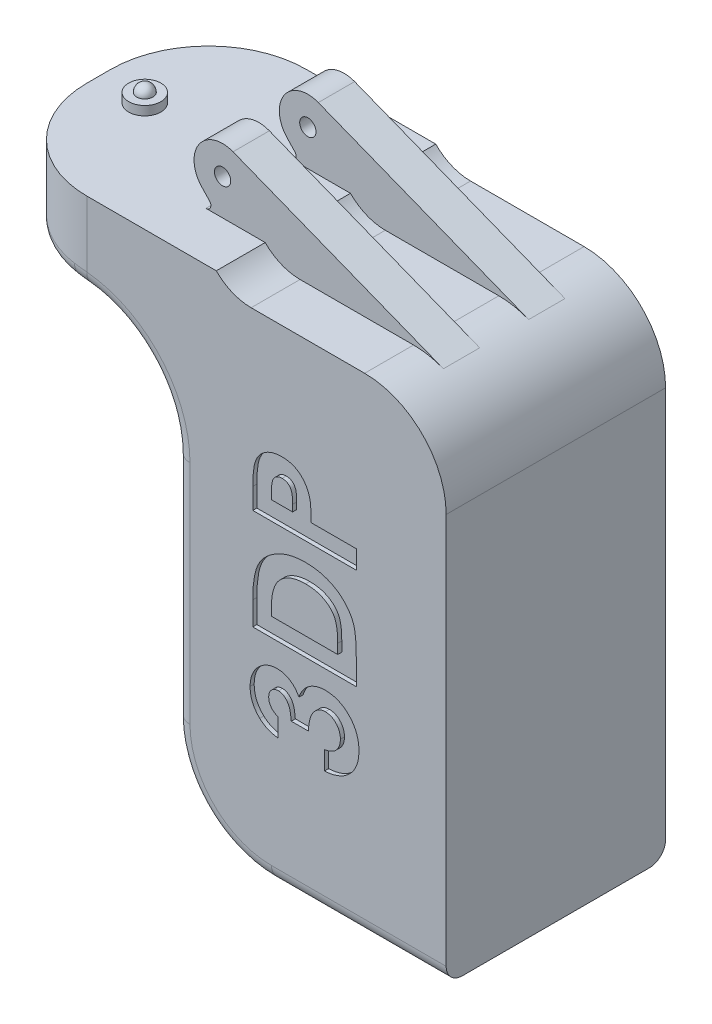
from build123d import *

# Parameters (mm, degrees)
BOSS_EXTRUDE1_DEPTH = 26.91519165
BOSS_EXTRUDE2_DEPTH = 26.91519165
FILLET1_R           = 12
FILLET2_R           = 12
SKETCH4_R           = 1.975
CUT_EXTRUDE1_DEPTH  = 5
FILLET3_R           = 2
FILLET4_R           = 0.6
SKETCH5_R           = 1
CUT_EXTRUDE2_DEPTH  = 33
SKETCH6_W           = 18.03011809
SKETCH6_H           = 6
CUT_EXTRUDE3_DEPTH  = 33
SKETCH7_W           = 12.282064414
SKETCH7_H           = 6
CUT_EXTRUDE4_DEPTH  = 33
FILLET5_R           = 10
BOSS_EXTRUDE3_DEPTH = 4.457595825
BOSS_EXTRUDE4_START = -4.457595825
BOSS_EXTRUDE4_DEPTH = 4.457595825
WRAP1_START         = -0.5
WRAP1_DEPTH         = 0.5
WRAP2_START         = -0.5
WRAP2_DEPTH         = 0.5
BOSS_EXTRUDE5_START = 6.11
SKETCH13_R          = 1.975
BOSS_EXTRUDE5_DEPTH = 6.11
SKETCH14_R          = 1
BOSS_EXTRUDE6_DEPTH = 1
FILLET6_R           = 1


# Read off the part's stored shape, not the designer's step: Wrap1, Wrap2
with BuildPart() as part:
    # Sketch1 → Boss-Extrude1 (new body)
    with BuildSketch(Plane.XY):
        with BuildLine():
            Line((20.5, -63.197553089), (50.42158649, -63.197553089))
            Line((50.42158649, -63.197553089), (50.42158649, -3.197553089))
            Line((50.42158649, -3.197553089), (26.5, -3.197553089))
            ThreePointArc((26.5, -3.197553089), (22.257359313, -1.440193776), (20.5, 2.802446911))
            Line((20.5, 2.802446911), (20.5, 3))
            ThreePointArc((20.5, 3), (15.70294041, 6.250790123), (14.461350617, 0.590589427))
            Line((14.461350617, 0.590589427), (17, -2.08423103))
            Line((17, -2.08423103), (17, -63.197553089))
            Line((17, -63.197553089), (20.5, -63.197553089))
        make_face()
    extrude(amount=-BOSS_EXTRUDE1_DEPTH)

    # Sketch3 → Boss-Extrude2 (add)
    with BuildSketch(Plane.XY):
        Polygon((16.359537753, -1.409414913), (-5.640462247, -1.409414913), (-5.640462247, -11.409414913), (17, -11.409414913), (17, -2.08423103), align=None)
    extrude(amount=-BOSS_EXTRUDE2_DEPTH)

    # Fillet1
    fillet1_edges = [part.edges().sort_by_distance(p)[0] for p in [
        (-5.640462247, -6.409414913, 0),
        (-5.640462247, -6.409414913, -26.91519165),
    ]]
    fillet(fillet1_edges, radius=FILLET1_R)

    # Fillet2
    fillet2_edges = [part.edges().sort_by_distance(p)[0] for p in [
        (17, -63.197553089, -13.457595825),
        (17, -11.409414913, -13.457595825),
    ]]
    fillet(fillet2_edges, radius=FILLET2_R)

    # Sketch4 → Cut-Extrude1 (cut)
    with BuildSketch(Plane(origin=(0, -1.409414913, 0), x_dir=(1, 0, 0), z_dir=(0, 1, 0))):
        with Locations(Location((0, 13.457595825, 0), (0, 0, 180))):
            Circle(SKETCH4_R)
    extrude(amount=-CUT_EXTRUDE1_DEPTH, mode=Mode.SUBTRACT)

    # Fillet3
    fillet3_edges = [part.edges().sort_by_distance(p)[0] for p in [
        (-5.640462247, -11.409414913, -13.457595825),
        (-2.593519072, -11.409414913, -22.90535895),
        (17, -37.303484001, -26.91519165),
        (17, -37.303484001, 0),
        (39.710793245, -63.197553089, 0),
        (20.514718626, -59.682834464, 0),
        (39.710793245, -63.197553089, -26.91519165),
        (20.514718626, -59.682834464, -26.91519165),
        (-2.593519072, -11.409414913, -4.0098327),
        (5.679768877, -11.428683956, -0.019269043),
        (13.953056825, -15.419247614, 0),
        (13.953056825, -15.419247614, -26.91519165),
        (5.679768877, -11.428683956, -26.895922607),
    ]]
    fillet(fillet3_edges, radius=FILLET3_R)

    # Fillet4
    fillet4_edges = [part.edges().sort_by_distance(p)[0] for p in [
        (16.359537753, -1.409414913, -13.457595825),
    ]]
    fillet(fillet4_edges, radius=FILLET4_R)

    # Sketch5 → Cut-Extrude2 (cut)
    with BuildSketch(Plane.XY):
        with Locations((17, 3)):
            Circle(SKETCH5_R)
    extrude(amount=-CUT_EXTRUDE2_DEPTH, mode=Mode.SUBTRACT)

    # Sketch6 → Cut-Extrude3 (cut)
    with BuildSketch(Plane(origin=(0, -1.409414913, 0), x_dir=(1, 0, 0), z_dir=(0, 1, 0))):
        with Locations((18.559970367, 3)):
            Rectangle(SKETCH6_W, SKETCH6_H)
    extrude(amount=CUT_EXTRUDE3_DEPTH, mode=Mode.SUBTRACT)

    # Sketch7 → Cut-Extrude4 (cut)
    with BuildSketch(Plane(origin=(0, -1.409414913, 0), x_dir=(1, 0, 0), z_dir=(0, 1, 0))):
        with Locations((16.08576993, 23.91519165)):
            Rectangle(SKETCH7_W, SKETCH7_H)
        with Locations((16.08576993, 13.457595825)):
            Rectangle(SKETCH7_W, SKETCH7_H)
    extrude(amount=CUT_EXTRUDE4_DEPTH, mode=Mode.SUBTRACT)

    # Fillet5
    fillet5_edges = [part.edges().sort_by_distance(p)[0] for p in [
        (50.42158649, -3.197553089, -13.457595825),
    ]]
    fillet(fillet5_edges, radius=FILLET5_R)

    # Sketch8 → Boss-Extrude3 (add)
    with BuildSketch(Plane.XY.offset(-6)):
        with BuildLine():
            Line((18.28116245, 6.257088082), (44.082050633, -3.89158714))
            ThreePointArc((44.082050633, -3.89158714), (42.284425788, -3.37259356), (40.42158649, -3.197553089))
            Line((40.42158649, -3.197553089), (26.5, -3.197553089))
            ThreePointArc((26.5, -3.197553089), (24.183879423, -2.732495318), (22.226802137, -1.409414913))
            ThreePointArc((22.226802137, -1.409414913), (20.948460251, 0.526396294), (20.5, 2.802446911))
            Line((20.5, 2.802446911), (20.5, 3))
            ThreePointArc((20.5, 3), (19.892582633, 4.970524223), (18.28116245, 6.257088082))
        make_face()
    extrude(amount=-BOSS_EXTRUDE3_DEPTH)

    # Sketch10 → Boss-Extrude4 (add)
    with BuildSketch(Plane(origin=(0, 0, -20.91519165), x_dir=(-1, 0, 0), z_dir=(0, 0, -1)).offset(BOSS_EXTRUDE4_START)):
        with BuildLine():
            Line((-44.082050633, -3.89158714), (-18.28116245, 6.257088082))
            ThreePointArc((-18.28116245, 6.257088082), (-19.892582633, 4.970524223), (-20.5, 3))
            Line((-20.5, 3), (-20.5, 2.802446911))
            ThreePointArc((-20.5, 2.802446911), (-20.948460251, 0.526396294), (-22.226802137, -1.409414913))
            ThreePointArc((-22.226802137, -1.409414913), (-24.183879423, -2.732495318), (-26.5, -3.197553089))
            Line((-26.5, -3.197553089), (-40.42158649, -3.197553089))
            ThreePointArc((-40.42158649, -3.197553089), (-42.284425788, -3.37259356), (-44.082050633, -3.89158714))
        make_face()
    extrude(amount=BOSS_EXTRUDE4_DEPTH)

    # Wrap1 outline → Wrap1 (cut)
    # profile 1 of 3: a face of its own
    with BuildSketch(Plane.XY.offset(WRAP1_START)):
        with BuildLine():
            add(Edge.make_bspline(
                [(29.793662682, -47.259674624), (29.679694315, -47.243680976), (29.457085889, -47.212441424), (29.134033392, -47.135646016), (28.826834298, -47.046836784), (28.53713725, -46.933262335), (28.265254543, -46.802161124), (28.010942879, -46.649279319), (27.770552672, -46.481710734), (27.626494259, -46.350515009), (27.554880631, -46.285295618)],
                knots=[0, 0, 0, 0, 0.138943325, 0.2713907, 0.400711228, 0.524932707, 0.646800357, 0.764858493, 0.883107579, 1, 1, 1, 1], degree=3))
            Line((29.793662682, -47.259674624), (29.793662682, -44.980187445))
            add(Edge.make_bspline(
                [(28.653919092, -43.494450265), (28.657984461, -43.577042735), (28.666051398, -43.740931491), (28.726260879, -43.980585907), (28.827616047, -44.208177758), (28.96737885, -44.418994259), (29.135228052, -44.60999223), (29.334010592, -44.766746459), (29.551817063, -44.897127195), (29.712731442, -44.952392155), (29.793662682, -44.980187445)],
                knots=[0, 0, 0, 0, 0.123522589, 0.245106649, 0.36726561, 0.494690546, 0.622323873, 0.746002836, 0.872253148, 1, 1, 1, 1], degree=3))
            add(Edge.make_bspline(
                [(29.849632233, -42.212238727), (29.766930947, -42.21661778), (29.605515545, -42.225164764), (29.374084101, -42.29284717), (29.166688952, -42.407707014), (28.985649891, -42.563553512), (28.837973958, -42.755012631), (28.728141079, -42.976591692), (28.664068623, -43.227167915), (28.657378891, -43.40333836), (28.653919092, -43.494450265)],
                knots=[0, 0, 0, 0, 0.126165598, 0.246248538, 0.364494603, 0.485724426, 0.608514578, 0.73130473, 0.861036067, 1, 1, 1, 1], degree=3))
            add(Edge.make_bspline(
                [(31.42186781, -44.654546419), (31.40904774, -44.503428084), (31.385063928, -44.220715606), (31.328187448, -43.828565407), (31.254610772, -43.497301408), (31.158720422, -43.223137182), (31.046713588, -42.99171911), (30.916934876, -42.792391977), (30.767908317, -42.618485027), (30.599851049, -42.475439303), (30.423692764, -42.356231745), (30.236339235, -42.27462788), (30.045244717, -42.21993119), (29.914444082, -42.214787453), (29.849632233, -42.212238727)],
                knots=[0, 0, 0, 0, 0.141725991, 0.265141262, 0.370116044, 0.458355648, 0.535986621, 0.609852304, 0.680090865, 0.749211452, 0.815601441, 0.878051616, 0.93957445, 1, 1, 1, 1], degree=3))
            Line((31.42186781, -44.654546419), (33.538534477, -44.654546419))
            add(Edge.make_bspline(
                [(35.591599381, -41.560956675), (35.521865865, -41.563278441), (35.383876528, -41.567872773), (35.181659761, -41.608302676), (34.986390275, -41.668820275), (34.799679191, -41.755855816), (34.622624577, -41.869745696), (34.45376006, -42.00822411), (34.294430079, -42.17254377), (34.139994301, -42.35720205), (34.004801952, -42.569649592), (33.880310015, -42.801307426), (33.78118375, -43.057882639), (33.692667259, -43.333219952), (33.628010792, -43.632496359), (33.581065463, -43.953862488), (33.546121475, -44.296797294), (33.541108222, -44.533186823), (33.538534477, -44.654546419)],
                knots=[0, 0, 0, 0, 0.050616766, 0.100160932, 0.149266408, 0.198883313, 0.249304704, 0.301846101, 0.357178164, 0.415398685, 0.476408327, 0.539798233, 0.60615782, 0.675919782, 0.74976587, 0.828276339, 0.911839098, 1, 1, 1, 1], degree=3))
            add(Edge.make_bspline(
                [(37.446226785, -43.560596098), (37.445011729, -43.490133273), (37.442631707, -43.352112362), (37.416491829, -43.149328443), (37.372939422, -42.956346104), (37.31535741, -42.771562698), (37.237218938, -42.597882151), (37.146539501, -42.431372035), (37.03553414, -42.27507746), (36.909054065, -42.129908906), (36.773996634, -41.994805434), (36.626208402, -41.879442714), (36.472785654, -41.779844315), (36.30967031, -41.701254478), (36.142011638, -41.635479646), (35.964480714, -41.594456903), (35.780931109, -41.563668655), (35.655339645, -41.561869688), (35.591599381, -41.560956675)],
                knots=[0, 0, 0, 0, 0.069418935, 0.135976164, 0.201068785, 0.264244252, 0.326365932, 0.38847074, 0.450850536, 0.514855453, 0.578097235, 0.638796917, 0.699312171, 0.757998888, 0.816988375, 0.876385038, 0.937262852, 1, 1, 1, 1], degree=3))
            add(Edge.make_bspline(
                [(35.492380631, -45.631469496), (35.572252479, -45.617021806), (35.727823851, -45.588881142), (35.953078761, -45.53404413), (36.160921135, -45.462395911), (36.35287794, -45.380480737), (36.530919166, -45.289913895), (36.690283678, -45.181702221), (36.837234507, -45.065675298), (37.006144585, -44.891260395), (37.183282522, -44.647911648), (37.340163988, -44.318431755), (37.429388386, -43.950244583), (37.440489168, -43.693367265), (37.446226785, -43.560596098)],
                knots=[0, 0, 0, 0, 0.077370852, 0.150700025, 0.220747386, 0.286665961, 0.349581574, 0.410791325, 0.470003976, 0.527741387, 0.64173813, 0.755286834, 0.87351607, 1, 1, 1, 1], degree=3))
            Line((35.492380631, -45.631469496), (35.492380631, -47.910956675))
            add(Edge.make_bspline(
                [(39.725713964, -43.685255553), (39.72247289, -43.833828888), (39.716135397, -44.124344383), (39.66128119, -44.549284097), (39.572796902, -44.953149071), (39.448070962, -45.336969976), (39.286322731, -45.69926184), (39.093716882, -46.043310066), (38.859144355, -46.362249248), (38.593194199, -46.659632995), (38.294813224, -46.92886444), (37.970913277, -47.169493949), (37.620262701, -47.3762156), (37.244359619, -47.54987716), (36.842544586, -47.689120989), (36.415634712, -47.798956113), (35.962795948, -47.875677745), (35.651233245, -47.899043478), (35.492380631, -47.910956675)],
                knots=[0, 0, 0, 0, 0.066659045, 0.130342942, 0.191936224, 0.251995802, 0.311121943, 0.3697548, 0.428602208, 0.488435845, 0.548524359, 0.60866107, 0.669235799, 0.730880799, 0.794196272, 0.859830406, 0.928533466, 1, 1, 1, 1], degree=3))
            add(Edge.make_bspline(
                [(35.614496015, -39.281469496), (35.75541144, -39.285828806), (36.03326796, -39.294424477), (36.442521412, -39.349073074), (36.832711166, -39.450814953), (37.208313016, -39.584675133), (37.564529662, -39.76318106), (37.909339638, -39.973432657), (38.231049551, -40.230787146), (38.535833303, -40.519386069), (38.814280771, -40.838218648), (39.060292199, -41.181303188), (39.263089604, -41.549304401), (39.436428178, -41.933325424), (39.565072658, -42.342017422), (39.659280759, -42.770093658), (39.716599833, -43.22068011), (39.722632856, -43.528201954), (39.725713964, -43.685255553)],
                knots=[0, 0, 0, 0, 0.062826775, 0.123881606, 0.183570574, 0.242287944, 0.301291813, 0.360878938, 0.421986412, 0.484557904, 0.547788277, 0.610411137, 0.672354816, 0.73480514, 0.797929196, 0.862961244, 0.93001333, 1, 1, 1, 1], degree=3))
            add(Edge.make_bspline(
                [(32.36571797, -41.63219065), (32.395435252, -41.541662854), (32.453828378, -41.363779795), (32.568904013, -41.110991399), (32.694395385, -40.870420668), (32.840893141, -40.647569372), (32.998243164, -40.436326343), (33.1749057, -40.243375025), (33.366346101, -40.063719006), (33.574600933, -39.901802756), (33.796207672, -39.757042122), (34.027183263, -39.629465989), (34.268371885, -39.522405635), (34.518001132, -39.432550417), (34.778527767, -39.363993374), (35.049068901, -39.315761008), (35.328972672, -39.287872438), (35.518608617, -39.283619798), (35.614496015, -39.281469496)],
                knots=[0, 0, 0, 0, 0.066210963, 0.130101573, 0.192891272, 0.254723742, 0.31534918, 0.375885633, 0.436387606, 0.497731609, 0.559069942, 0.62030329, 0.681020445, 0.742389955, 0.80461491, 0.86812333, 0.933317965, 1, 1, 1, 1], degree=3))
            add(Edge.make_bspline(
                [(29.704620214, -39.932751547), (29.842416769, -39.938147512), (30.114526826, -39.948803049), (30.511996536, -40.033072716), (30.891185338, -40.168541012), (31.247600382, -40.361156854), (31.58087039, -40.603040267), (31.879355738, -40.899664437), (32.147678995, -41.242751757), (32.291877756, -41.500304819), (32.36571797, -41.63219065)],
                knots=[0, 0, 0, 0, 0.124097087, 0.245057399, 0.36448446, 0.485868975, 0.60892619, 0.734308661, 0.863946782, 1, 1, 1, 1], degree=3))
            add(Edge.make_bspline(
                [(26.374431913, -43.479185842), (26.37733782, -43.35609612), (26.383050248, -43.114126531), (26.428906519, -42.758492119), (26.509333311, -42.419424469), (26.614489538, -42.093339536), (26.757572159, -41.785032969), (26.923660628, -41.487700142), (27.127375037, -41.209648544), (27.357551818, -40.950227588), (27.60651054, -40.711899962), (27.872626939, -40.505507193), (28.148792434, -40.328067627), (28.437301437, -40.181880894), (28.73864214, -40.069483162), (29.051073738, -39.991475802), (29.373906829, -39.940418092), (29.593332132, -39.93533141), (29.704620214, -39.932751547)],
                knots=[0, 0, 0, 0, 0.068213911, 0.134094803, 0.198285615, 0.261160186, 0.323634654, 0.38636675, 0.449642386, 0.514244902, 0.578413338, 0.640374686, 0.70061485, 0.760103977, 0.81929898, 0.878465984, 0.938360402, 1, 1, 1, 1], degree=3))
            add(Edge.make_bspline(
                [(27.554880631, -46.285295618), (27.460245557, -46.191457288), (27.273729773, -46.006511803), (27.034823657, -45.697446207), (26.82806666, -45.373488384), (26.664148218, -45.02814122), (26.531475228, -44.666778575), (26.442358481, -44.28652677), (26.383228733, -43.88893965), (26.377404247, -43.617636458), (26.374431913, -43.479185842)],
                knots=[0, 0, 0, 0, 0.127406864, 0.251105539, 0.372907792, 0.494496302, 0.616171436, 0.740562898, 0.867604851, 1, 1, 1, 1], degree=3))
        make_face()
    # profile 2 of 3: a face of its own
    with BuildSketch(Plane.XY.offset(WRAP1_START)):
        with BuildLine():
            add(Edge.make_bspline(
                [(26.700072938, -34.129726707), (26.701602041, -33.905795857), (26.704557813, -33.472934992), (26.73913827, -32.845894461), (26.789912576, -32.262388484), (26.867639291, -31.723746195), (26.957795121, -31.227997365), (27.078733297, -30.778902431), (27.216634224, -30.373204929), (27.379324524, -30.006964684), (27.568904674, -29.672607458), (27.78010635, -29.355128565), (28.020637712, -29.055146138), (28.285866069, -28.768451804), (28.580641597, -28.498745033), (28.900082319, -28.241534344), (29.248820405, -28.003117396), (29.618494261, -27.776287366), (30.010670516, -27.571149788), (30.422011051, -27.392221126), (30.849868736, -27.242331502), (31.294699556, -27.120538419), (31.755026808, -27.023455277), (32.231779389, -26.955528159), (32.724515906, -26.913534938), (33.058467638, -26.909275076), (33.228157874, -26.907110521)],
                knots=[0, 0, 0, 0, 0.060148874, 0.116268453, 0.168655952, 0.21743294, 0.262424792, 0.303924461, 0.342252181, 0.37743397, 0.411399132, 0.445391786, 0.479760229, 0.514578736, 0.550208327, 0.586996019, 0.624658544, 0.663611474, 0.703452918, 0.743447125, 0.784010829, 0.825130466, 0.867263092, 0.910305411, 0.954423665, 1, 1, 1, 1], degree=3))
            Line((26.700072938, -34.129726707), (26.700072938, -37.001982316))
            Line((26.700072938, -37.001982316), (39.400072938, -37.001982316))
            Line((39.400072938, -37.001982316), (39.400072938, -34.086477509))
            add(Edge.make_bspline(
                [(33.228157874, -26.907110521), (33.467601844, -26.912778495), (33.938961313, -26.923936232), (34.630675905, -27.017922776), (35.293753331, -27.169930842), (35.923006744, -27.383667989), (36.512832544, -27.648644836), (37.052829427, -27.965189349), (37.540098861, -28.328660259), (37.972215016, -28.73482307), (38.343623694, -29.174598582), (38.661711623, -29.63161364), (38.912537941, -30.110322131), (39.071637644, -30.532127029), (39.17049322, -30.897894585), (39.229227491, -31.219000738), (39.281638665, -31.583991303), (39.328451546, -31.995286488), (39.359650825, -32.452845815), (39.381498194, -32.956746724), (39.397647795, -33.506328066), (39.399243376, -33.888027214), (39.400072938, -34.086477509)],
                knots=[0, 0, 0, 0, 0.065772437, 0.129476892, 0.191428604, 0.252443711, 0.311784541, 0.368814691, 0.42408823, 0.478488396, 0.531389624, 0.581999458, 0.631196377, 0.67949774, 0.705555904, 0.735216023, 0.769126523, 0.806877245, 0.848930943, 0.895117474, 0.945470227, 1, 1, 1, 1], degree=3))
        make_face()
        with BuildLine():
            add(Edge.make_bspline(
                [(37.120585759, -33.531870137), (37.119899873, -33.390228608), (37.118580886, -33.11784605), (37.100458158, -32.72410683), (37.071029, -32.360739082), (37.027498843, -32.027266845), (36.975120922, -31.722923489), (36.910336338, -31.448819175), (36.83155335, -31.20441365), (36.738706801, -30.987691442), (36.632701869, -30.789828851), (36.508920795, -30.606525159), (36.371360763, -30.429614765), (36.216100559, -30.262367314), (36.045162194, -30.104160228), (35.857674297, -29.955926689), (35.654206307, -29.815688968), (35.433683163, -29.687046482), (35.198433435, -29.569492301), (34.950735917, -29.465208567), (34.688527805, -29.378741964), (34.414263688, -29.306876217), (34.125555784, -29.255519992), (33.824542513, -29.213032511), (33.510031286, -29.191128977), (33.296027335, -29.188122853), (33.187452746, -29.186597701)],
                knots=[0, 0, 0, 0, 0.062612326, 0.120406111, 0.174204843, 0.223728185, 0.269030291, 0.310675957, 0.348139427, 0.382401014, 0.41477486, 0.447215928, 0.480063858, 0.51375667, 0.547979264, 0.582933279, 0.619329216, 0.657136258, 0.695697859, 0.735523522, 0.775831512, 0.817659023, 0.860747747, 0.905390435, 0.951999977, 1, 1, 1, 1], degree=3))
            Line((37.120585759, -33.531870137), (37.120585759, -34.722495137))
            Line((37.120585759, -34.722495137), (28.979560118, -34.722495137))
            Line((28.979560118, -34.722495137), (28.979560118, -33.852423021))
            add(Edge.make_bspline(
                [(29.997188323, -30.384854912), (29.914513245, -30.479314588), (29.745658759, -30.672237781), (29.543327904, -31.010947509), (29.365560415, -31.384188086), (29.224610622, -31.80049814), (29.113141516, -32.255854217), (29.036264, -32.752968428), (28.986863323, -33.289178618), (28.982046675, -33.660652544), (28.979560118, -33.852423021)],
                knots=[0, 0, 0, 0, 0.101663476, 0.207636138, 0.318744567, 0.436679942, 0.563506646, 0.698681208, 0.844446556, 1, 1, 1, 1], degree=3))
            add(Edge.make_bspline(
                [(33.187452746, -29.186597701), (33.021068674, -29.189624393), (32.696632625, -29.195526208), (32.224147528, -29.252797822), (31.779788909, -29.345079103), (31.364698281, -29.479507423), (30.976236729, -29.644819104), (30.619410066, -29.855016361), (30.288369519, -30.097329689), (30.094206114, -30.289055244), (29.997188323, -30.384854912)],
                knots=[0, 0, 0, 0, 0.142280365, 0.277435688, 0.406487662, 0.529917848, 0.650133875, 0.766844668, 0.88349908, 1, 1, 1, 1], degree=3))
        make_face(mode=Mode.SUBTRACT)
    # profile 3 of 3: a face of its own
    with BuildSketch(Plane.XY.offset(WRAP1_START)):
        with BuildLine():
            add(Edge.make_bspline(
                [(26.700072938, -22.083552829), (26.700817001, -21.917326561), (26.702252455, -21.596641247), (26.719659281, -21.134186657), (26.750853288, -20.707549596), (26.789404406, -20.31682834), (26.843450697, -19.962182705), (26.905413212, -19.643171282), (26.980892876, -19.359719159), (27.070513958, -19.108657994), (27.17608129, -18.883269215), (27.288838892, -18.670229349), (27.422495572, -18.472744789), (27.567417095, -18.286179159), (27.726618424, -18.111943735), (27.899470362, -17.9487474), (28.08848495, -17.798270622), (28.292360047, -17.661456795), (28.506944899, -17.537277383), (28.732728851, -17.428803993), (28.970040429, -17.340811847), (29.217352269, -17.266998673), (29.474651457, -17.207710866), (29.743520998, -17.168247098), (30.022083378, -17.141441297), (30.211673116, -17.139076057), (30.307564926, -17.137879752)],
                knots=[0, 0, 0, 0, 0.070782813, 0.136554884, 0.197017081, 0.252928598, 0.303693621, 0.349727315, 0.391249604, 0.428488557, 0.463067374, 0.497161963, 0.531014729, 0.564460573, 0.597691279, 0.631412817, 0.665589541, 0.700444444, 0.735874519, 0.771086765, 0.806970339, 0.84353075, 0.880937416, 0.9192925, 0.959179287, 1, 1, 1, 1], degree=3))
            Line((26.700072938, -22.083552829), (26.700072938, -24.627623342))
            Line((26.700072938, -24.627623342), (39.400072938, -24.627623342))
            Line((39.400072938, -24.627623342), (39.400072938, -22.348136162))
            Line((39.400072938, -22.348136162), (33.864175502, -22.348136162))
            add(Edge.make_bspline(
                [(33.670826144, -19.760816451), (33.687024281, -19.825921081), (33.722114662, -19.966958675), (33.757740207, -20.200337155), (33.790495705, -20.469281349), (33.81864509, -20.774660931), (33.837780113, -21.116651958), (33.852723715, -21.494923294), (33.863589256, -21.909646365), (33.863974813, -22.19802839), (33.864175502, -22.348136162)],
                knots=[0, 0, 0, 0, 0.077372749, 0.167614291, 0.272108317, 0.390015992, 0.52136331, 0.667272254, 0.826809521, 1, 1, 1, 1], degree=3))
            add(Edge.make_bspline(
                [(30.307564926, -17.137879752), (30.41364775, -17.139610657), (30.622113537, -17.143012097), (30.927698814, -17.176357162), (31.21904667, -17.233321097), (31.498614271, -17.307769884), (31.761801475, -17.411583781), (32.014890331, -17.530185046), (32.250776514, -17.67610688), (32.472442478, -17.842828857), (32.681571719, -18.024971364), (32.872566669, -18.226564463), (33.045370282, -18.445233691), (33.207455414, -18.674906282), (33.345843948, -18.925046025), (33.474930503, -19.186896398), (33.584309307, -19.467049464), (33.641719441, -19.661984956), (33.670826144, -19.760816451)],
                knots=[0, 0, 0, 0, 0.068872788, 0.135343493, 0.199281685, 0.261540067, 0.322903021, 0.382757342, 0.442826617, 0.502632784, 0.562727297, 0.622715739, 0.682661194, 0.743612561, 0.80501998, 0.868072172, 0.933113132, 1, 1, 1, 1], degree=3))
        make_face()
        with BuildLine():
            add(Edge.make_bspline(
                [(31.584688323, -21.54166581), (31.583757964, -21.394915623), (31.58204609, -21.124893098), (31.557285692, -20.756140104), (31.519478886, -20.459796041), (31.465236039, -20.225697419), (31.382970387, -20.040800969), (31.287637979, -19.881520202), (31.167270123, -19.743766196), (31.027412074, -19.627020793), (30.869864608, -19.532154818), (30.695049852, -19.465470042), (30.505460647, -19.42341865), (30.37309273, -19.419422171), (30.305020855, -19.417366932)],
                knots=[0, 0, 0, 0, 0.155183108, 0.285539224, 0.390561991, 0.471046427, 0.538527135, 0.603746832, 0.666688199, 0.730994992, 0.79575053, 0.860207253, 0.928109812, 1, 1, 1, 1], degree=3))
            Line((31.584688323, -21.54166581), (31.584688323, -22.348136162))
            Line((31.584688323, -22.348136162), (28.979560118, -22.348136162))
            Line((28.979560118, -22.348136162), (28.979560118, -21.630708278))
            add(Edge.make_bspline(
                [(29.231423099, -20.015223502), (29.211033986, -20.05553981), (29.167866055, -20.140897695), (29.11768018, -20.28627045), (29.075342866, -20.454028388), (29.040203304, -20.645304066), (29.012931355, -20.85933443), (28.992075136, -21.096081293), (28.983688038, -21.35589305), (28.980974043, -21.536576582), (28.979560118, -21.630708278)],
                knots=[0, 0, 0, 0, 0.08210116, 0.173824981, 0.278953094, 0.396639095, 0.527315592, 0.671298143, 0.82875438, 1, 1, 1, 1], degree=3))
            add(Edge.make_bspline(
                [(30.305020855, -19.417366932), (30.245531576, -19.419357276), (30.130108071, -19.423219021), (29.96364049, -19.451979434), (29.808762722, -19.496617062), (29.66763372, -19.564837016), (29.536961778, -19.647662256), (29.420814746, -19.752736375), (29.315434874, -19.873908431), (29.259725884, -19.967615769), (29.231423099, -20.015223502)],
                knots=[0, 0, 0, 0, 0.137806221, 0.267377201, 0.390496855, 0.51006691, 0.629459141, 0.747795142, 0.871868075, 1, 1, 1, 1], degree=3))
        make_face(mode=Mode.SUBTRACT)
    extrude(amount=WRAP1_DEPTH, mode=Mode.SUBTRACT)

    # Wrap2 outline → Wrap2 (cut)
    # profile 1 of 3: a face of its own
    with BuildSketch(Plane(origin=(0, 0, -26.91519165), x_dir=(-1, 0, 0), z_dir=(0, 0, -1)).offset(WRAP2_START)):
        with BuildLine():
            add(Edge.make_bspline(
                [(-28.287572938, -42.789742733), (-28.288223995, -42.935190717), (-28.289480018, -43.215790365), (-28.304710977, -43.620438143), (-28.332005783, -43.993745531), (-28.365737846, -44.335626763), (-28.413028886, -44.645941264), (-28.467244362, -44.925077642), (-28.533294589, -45.173093824), (-28.611695294, -45.392786562), (-28.704126662, -45.589953698), (-28.802572667, -45.7765374), (-28.920064501, -45.948320858), (-29.043939394, -46.1139745), (-29.186031068, -46.264027622), (-29.336883113, -46.407841437), (-29.5024782, -46.539325037), (-29.680811844, -46.659087668), (-29.868589201, -46.767730828), (-30.066145962, -46.862648761), (-30.27379474, -46.939640873), (-30.490192284, -47.004227681), (-30.715329161, -47.056104434), (-30.950589985, -47.090635253), (-31.194332074, -47.114090322), (-31.360223094, -47.116159908), (-31.444128427, -47.117206675)],
                knots=[0, 0, 0, 0, 0.070781161, 0.136551696, 0.197012482, 0.252922694, 0.303686532, 0.349719151, 0.391240471, 0.428478555, 0.463056565, 0.497150358, 0.531002334, 0.564226377, 0.59770067, 0.631421421, 0.665597347, 0.700451436, 0.735880684, 0.771092108, 0.806974845, 0.843534403, 0.880940196, 0.919294384, 0.95918024, 1, 1, 1, 1], degree=3))
            Line((-28.287572938, -42.789742733), (-28.287572938, -40.563681034))
            Line((-28.287572938, -40.563681034), (-39.400072938, -40.563681034))
            Line((-39.400072938, -40.563681034), (-39.400072938, -42.558232316))
            Line((-39.400072938, -42.558232316), (-34.556162682, -42.558232316))
            add(Edge.make_bspline(
                [(-34.386981993, -44.822137064), (-34.401155363, -44.765170513), (-34.431859447, -44.641762618), (-34.463031799, -44.437556448), (-34.491692859, -44.202230278), (-34.516323571, -43.935023144), (-34.533066716, -43.635780995), (-34.546142368, -43.304793576), (-34.555649717, -42.941910889), (-34.555987079, -42.689576617), (-34.556162682, -42.558232316)],
                knots=[0, 0, 0, 0, 0.077372749, 0.167614291, 0.272108317, 0.390015992, 0.52136331, 0.667272254, 0.826809521, 1, 1, 1, 1], degree=3))
            add(Edge.make_bspline(
                [(-31.444128427, -47.117206675), (-31.536953589, -47.1156987), (-31.719366438, -47.112735343), (-31.986715453, -47.083465404), (-32.24178206, -47.033956943), (-32.485655749, -46.967678892), (-32.717803555, -46.881228717), (-32.936698432, -46.772876615), (-33.145090744, -46.648940605), (-33.339141372, -46.502614356), (-33.519941978, -46.340978275), (-33.689073682, -46.166730769), (-33.840760074, -45.975922153), (-33.977894661, -45.771211318), (-34.103334712, -45.554292429), (-34.21532969, -45.324170805), (-34.311343496, -45.079221454), (-34.36153507, -44.908627499), (-34.386981993, -44.822137064)],
                knots=[0, 0, 0, 0, 0.068862946, 0.135324151, 0.199253206, 0.26150269, 0.322661372, 0.382747297, 0.442522097, 0.502319717, 0.562770359, 0.622352107, 0.682288995, 0.743375754, 0.805047844, 0.868091026, 0.933122691, 1, 1, 1, 1], degree=3))
        make_face()
        with BuildLine():
            add(Edge.make_bspline(
                [(-32.5616114, -43.263893875), (-32.560800105, -43.392302083), (-32.559307311, -43.628575094), (-32.537610461, -43.95121355), (-32.504616386, -44.210570907), (-32.456925665, -44.415259299), (-32.385866665, -44.57689616), (-32.300307361, -44.714783459), (-32.19733753, -44.836284287), (-32.075941438, -44.939765458), (-31.937796285, -45.02272296), (-31.78375377, -45.08012126), (-31.617315346, -45.117439733), (-31.501474821, -45.120884089), (-31.441902365, -45.122655393)],
                knots=[0, 0, 0, 0, 0.155172457, 0.285519625, 0.390535184, 0.471014095, 0.538490172, 0.60294247, 0.666559525, 0.730176579, 0.794927673, 0.860216848, 0.928114746, 1, 1, 1, 1], degree=3))
            Line((-32.5616114, -43.263893875), (-32.5616114, -42.558232316))
            Line((-32.5616114, -42.558232316), (-30.28212422, -42.558232316))
            Line((-30.28212422, -42.558232316), (-30.28212422, -43.185981715))
            add(Edge.make_bspline(
                [(-30.502504329, -44.599530894), (-30.484663855, -44.564254125), (-30.446891916, -44.489565975), (-30.402979275, -44.362364815), (-30.365934125, -44.215576619), (-30.335187008, -44.048210401), (-30.311324053, -43.860933832), (-30.293074861, -43.653780327), (-30.28573615, -43.42644504), (-30.283361405, -43.26834695), (-30.28212422, -43.185981715)],
                knots=[0, 0, 0, 0, 0.08210116, 0.173824981, 0.278953094, 0.396639095, 0.527315592, 0.671298143, 0.82875438, 1, 1, 1, 1], degree=3))
            add(Edge.make_bspline(
                [(-31.441902365, -45.122655393), (-31.389855475, -45.120901587), (-31.288871992, -45.11749878), (-31.143127779, -45.092500836), (-31.007264107, -45.052661305), (-30.882699892, -44.994935356), (-30.769646789, -44.920309373), (-30.668149332, -44.829325197), (-30.576033869, -44.723150335), (-30.527275747, -44.641177134), (-30.502504329, -44.599530894)],
                knots=[0, 0, 0, 0, 0.137787685, 0.267341238, 0.390444331, 0.511777883, 0.629508981, 0.747829066, 0.87188531, 1, 1, 1, 1], degree=3))
        make_face(mode=Mode.SUBTRACT)
    # profile 2 of 3: a face of its own
    with BuildSketch(Plane(origin=(0, 0, -26.91519165), x_dir=(-1, 0, 0), z_dir=(0, 0, -1)).offset(WRAP2_START)):
        with BuildLine():
            add(Edge.make_bspline(
                [(-28.287572938, -32.24934059), (-28.288942662, -32.44527525), (-28.291590355, -32.824019164), (-28.321420886, -33.372744668), (-28.367303038, -33.882987756), (-28.430406229, -34.355085348), (-28.513961784, -34.788042865), (-28.618593746, -35.181390544), (-28.740150314, -35.536797385), (-28.881413673, -35.858438205), (-29.04717177, -36.151249745), (-29.233372438, -36.427315816), (-29.442834184, -36.689818875), (-29.676037929, -36.940214885), (-29.93143493, -37.179113731), (-30.214167316, -37.400907555), (-30.51691208, -37.612706879), (-30.840719934, -37.81107525), (-31.184951612, -37.987647874), (-31.544189152, -38.144817305), (-31.918666035, -38.275767829), (-32.307865204, -38.382392395), (-32.710659242, -38.467324754), (-33.127815622, -38.526765242), (-33.558960656, -38.563508146), (-33.851168341, -38.567235685), (-33.999647257, -38.569129752)],
                knots=[0, 0, 0, 0, 0.060144747, 0.116260476, 0.168644381, 0.217386628, 0.262418625, 0.303915448, 0.342240538, 0.377628014, 0.411590846, 0.445392104, 0.479758189, 0.514574308, 0.550356234, 0.586999359, 0.624789284, 0.663739542, 0.703473262, 0.743464725, 0.784025647, 0.825142463, 0.867272198, 0.910311565, 0.954426792, 1, 1, 1, 1], degree=3))
            Line((-28.287572938, -32.24934059), (-28.287572938, -29.736116932))
            Line((-28.287572938, -29.736116932), (-39.400072938, -29.736116932))
            Line((-39.400072938, -29.736116932), (-39.400072938, -32.287183638))
            add(Edge.make_bspline(
                [(-33.999647257, -38.569129752), (-34.209160948, -38.564170564), (-34.621600913, -38.554408111), (-35.226848072, -38.472165771), (-35.807052185, -38.339173751), (-36.357607687, -38.152099189), (-36.873852726, -37.92043956), (-37.345445995, -37.642998552), (-37.773348867, -37.327745833), (-38.150461231, -36.97188387), (-38.476579833, -36.587180697), (-38.752619925, -36.185830282), (-38.974203331, -35.768193178), (-39.112543159, -35.399417782), (-39.199569423, -35.078751587), (-39.24985606, -34.797597262), (-39.297756495, -34.477832869), (-39.333333744, -34.117402026), (-39.365942507, -33.716772141), (-39.38344234, -33.275666027), (-39.398058222, -32.794823503), (-39.399383769, -32.46083076), (-39.400072938, -32.287183638)],
                knots=[0, 0, 0, 0, 0.065767895, 0.12946795, 0.191415385, 0.252426279, 0.311763011, 0.368789222, 0.42391977, 0.478316179, 0.531213754, 0.582012304, 0.630999561, 0.679297588, 0.705353953, 0.735240885, 0.76891849, 0.806873155, 0.848941375, 0.895124717, 0.945473992, 1, 1, 1, 1], degree=3))
        make_face()
        with BuildLine():
            add(Edge.make_bspline(
                [(-37.405521656, -32.772465089), (-37.405294514, -32.896422917), (-37.404857644, -33.134835088), (-37.384049159, -33.479048294), (-37.363163177, -33.797358232), (-37.323520886, -34.088888669), (-37.279362163, -34.355761273), (-37.217909254, -34.594309913), (-37.153358178, -34.809452113), (-37.071176658, -34.998559951), (-36.978675889, -35.171767326), (-36.870300512, -35.332137562), (-36.74995375, -35.486939769), (-36.614095999, -35.633279656), (-36.464526402, -35.771711619), (-36.300473792, -35.90141454), (-36.122440655, -36.024127738), (-35.92947798, -36.136669632), (-35.723653434, -36.239608089), (-35.506844532, -36.330551542), (-35.277869345, -36.407324468), (-35.036829222, -36.465626025), (-34.785219923, -36.51529127), (-34.52142368, -36.551153385), (-34.246302328, -36.570691189), (-34.059038366, -36.573270076), (-33.96403027, -36.57457847)],
                knots=[0, 0, 0, 0, 0.062616053, 0.120431515, 0.174203394, 0.223729684, 0.269034486, 0.310771974, 0.348123068, 0.382386694, 0.414762466, 0.447205465, 0.48005535, 0.513750168, 0.547974798, 0.582930893, 0.619328996, 0.657138289, 0.695702185, 0.735530218, 0.775840607, 0.817578094, 0.860739459, 0.905384805, 0.95199712, 1, 1, 1, 1], degree=3))
            Line((-37.405521656, -32.772465089), (-37.405521656, -31.730668214))
            Line((-37.405521656, -31.730668214), (-30.28212422, -31.730668214))
            Line((-30.28212422, -31.730668214), (-30.28212422, -32.491981315))
            add(Edge.make_bspline(
                [(-31.1725489, -35.52610341), (-31.100208207, -35.443451194), (-30.952460532, -35.2746434), (-30.775421033, -34.978272388), (-30.619874481, -34.651686883), (-30.496543411, -34.287415586), (-30.399007944, -33.888979019), (-30.331740117, -33.454004084), (-30.288514525, -32.984820167), (-30.284299958, -32.659780482), (-30.28212422, -32.491981315)],
                knots=[0, 0, 0, 0, 0.101663476, 0.207636138, 0.318744567, 0.436679942, 0.563506646, 0.698681208, 0.844446556, 1, 1, 1, 1], degree=3))
            add(Edge.make_bspline(
                [(-33.96403027, -36.57457847), (-33.818447513, -36.571920583), (-33.534572418, -36.566737908), (-33.121102145, -36.516757315), (-32.731757943, -36.435398444), (-32.367984771, -36.319307173), (-32.028760238, -36.172970529), (-31.716958292, -35.989796106), (-31.42734109, -35.777667026), (-31.257442347, -35.609921138), (-31.1725489, -35.52610341)],
                knots=[0, 0, 0, 0, 0.142276686, 0.277428514, 0.406477152, 0.530595072, 0.650142922, 0.766850697, 0.883502093, 1, 1, 1, 1], degree=3))
        make_face(mode=Mode.SUBTRACT)
    # profile 3 of 3: a face of its own
    with BuildSketch(Plane(origin=(0, 0, -26.91519165), x_dir=(-1, 0, 0), z_dir=(0, 0, -1)).offset(WRAP2_START)):
        with BuildLine():
            add(Edge.make_bspline(
                [(-30.994463964, -20.760636162), (-30.894763461, -20.774718453), (-30.699307229, -20.802325851), (-30.416335296, -20.868386662), (-30.147917051, -20.947402521), (-29.894902521, -21.046049783), (-29.656841002, -21.161746973), (-29.432915585, -21.29331758), (-29.224087398, -21.442183932), (-29.098288469, -21.556291567), (-29.035529669, -21.613217793)],
                knots=[0, 0, 0, 0, 0.138934236, 0.272371367, 0.40070198, 0.524915333, 0.646775011, 0.765706493, 0.883115226, 1, 1, 1, 1], degree=3))
            Line((-30.994463964, -20.760636162), (-30.994463964, -22.755187445))
            add(Edge.make_bspline(
                [(-29.997188323, -24.055207477), (-30.0007376, -23.982934263), (-30.007780453, -23.839522072), (-30.060580391, -23.629895178), (-30.148564021, -23.431048788), (-30.272118013, -23.248082484), (-30.418976915, -23.081446248), (-30.591500925, -22.941725154), (-30.782942004, -22.827983537), (-30.923680236, -22.779547936), (-30.994463964, -22.755187445)],
                knots=[0, 0, 0, 0, 0.123554901, 0.245170767, 0.367361683, 0.493759818, 0.621426533, 0.745936393, 0.872219731, 1, 1, 1, 1], degree=3))
            add(Edge.make_bspline(
                [(-31.043437321, -25.177142573), (-30.971058463, -25.17333405), (-30.829790254, -25.165900621), (-30.628476982, -25.106640973), (-30.446972246, -25.008134648), (-30.289979382, -24.871127723), (-30.157245789, -24.704866783), (-30.062818904, -24.508686542), (-30.005925706, -24.289161823), (-30.000166745, -24.134958445), (-29.997188323, -24.055207477)],
                knots=[0, 0, 0, 0, 0.126140226, 0.246199017, 0.362663837, 0.48386928, 0.607431108, 0.731358764, 0.861064012, 1, 1, 1, 1], degree=3))
            add(Edge.make_bspline(
                [(-32.419143451, -23.040123342), (-32.407873769, -23.1723331), (-32.386790426, -23.419671374), (-32.337651313, -23.76302907), (-32.271287486, -24.052654283), (-32.192612762, -24.295277584), (-32.091032649, -24.496447235), (-31.976188821, -24.670139499), (-31.847605098, -24.822785559), (-31.702348966, -24.95081949), (-31.545308366, -25.050091713), (-31.381968066, -25.122799188), (-31.214558805, -25.170351548), (-31.100134622, -25.174892518), (-31.043437321, -25.177142573)],
                knots=[0, 0, 0, 0, 0.141666715, 0.265030369, 0.369961247, 0.45865363, 0.536603215, 0.609776179, 0.680586271, 0.749080294, 0.815678564, 0.87810262, 0.939599723, 1, 1, 1, 1], degree=3))
            Line((-32.419143451, -23.040123342), (-34.271226785, -23.040123342))
            add(Edge.make_bspline(
                [(-36.067658575, -25.747014368), (-36.006659818, -25.744901494), (-35.885225268, -25.740695248), (-35.708017077, -25.706329773), (-35.53755708, -25.652059425), (-35.374600153, -25.576671283), (-35.219746923, -25.475998821), (-35.069890566, -25.357206439), (-34.932830838, -25.210935261), (-34.79735145, -25.05045619), (-34.679254284, -24.864363513), (-34.570267952, -24.661720202), (-34.483548479, -24.437200478), (-34.406091927, -24.196285068), (-34.349518865, -23.934416831), (-34.308441308, -23.653221873), (-34.277865433, -23.353153802), (-34.27347882, -23.14631298), (-34.271226785, -23.040123342)],
                knots=[0, 0, 0, 0, 0.05061342, 0.100759723, 0.149274813, 0.198888438, 0.249306497, 0.302322686, 0.357220648, 0.415437322, 0.476442931, 0.539828648, 0.606183849, 0.675941201, 0.749782408, 0.828287688, 0.911844924, 1, 1, 1, 1], degree=3))
            add(Edge.make_bspline(
                [(-37.690457554, -23.997329872), (-37.689402386, -24.058988404), (-37.687335549, -24.179763675), (-37.664350078, -24.357149325), (-37.626654487, -24.5261924), (-37.57466729, -24.68758775), (-37.511385362, -24.84264871), (-37.427703876, -24.987000296), (-37.331051735, -25.123605818), (-37.223524896, -25.252210715), (-37.102698001, -25.367777287), (-36.974929088, -25.469727183), (-36.839420933, -25.55636908), (-36.696471738, -25.623733494), (-36.549301873, -25.681881007), (-36.393920797, -25.717681281), (-36.233326178, -25.744646718), (-36.123432094, -25.746217277), (-36.067658575, -25.747014368)],
                knots=[0, 0, 0, 0, 0.069384772, 0.135909246, 0.200969833, 0.26411421, 0.326642151, 0.389125428, 0.451474526, 0.514905623, 0.577533939, 0.639377267, 0.69870942, 0.758117983, 0.817078441, 0.876445872, 0.937293726, 1, 1, 1, 1], degree=3))
            add(Edge.make_bspline(
                [(-35.980842169, -22.18531565), (-36.050731202, -22.197954913), (-36.18685842, -22.222573193), (-36.383940371, -22.270589639), (-36.565859185, -22.333161767), (-36.73423175, -22.405510715), (-36.89126874, -22.48365847), (-37.031170391, -22.578079647), (-37.157735607, -22.681855557), (-37.308197729, -22.831604951), (-37.462791279, -23.045682025), (-37.597140428, -23.334756997), (-37.675885535, -23.656325529), (-37.685492197, -23.881134002), (-37.690457554, -23.997329872)],
                knots=[0, 0, 0, 0, 0.077346353, 0.150652305, 0.220677485, 0.286575187, 0.35018847, 0.411378839, 0.469946039, 0.528233786, 0.642194432, 0.755364323, 0.873556122, 1, 1, 1, 1], degree=3))
            Line((-35.980842169, -22.18531565), (-35.980842169, -20.190764368))
            add(Edge.make_bspline(
                [(-39.685008836, -23.888252849), (-39.682173627, -23.758250756), (-39.67662975, -23.504048866), (-39.628622076, -23.132232577), (-39.551235344, -22.778829181), (-39.441966731, -22.44306353), (-39.30118605, -22.126365126), (-39.131261428, -21.826888881), (-38.926986358, -21.547904156), (-38.693180437, -21.28812654), (-38.434477067, -21.049758366), (-38.148767533, -20.842011183), (-37.842294839, -20.661216375), (-37.514399903, -20.506180724), (-37.16215702, -20.385048016), (-36.788711855, -20.288714384), (-36.392449607, -20.221646894), (-36.119836193, -20.201192961), (-35.980842169, -20.190764368)],
                knots=[0, 0, 0, 0, 0.066668342, 0.130361121, 0.191962993, 0.252030948, 0.311165336, 0.369475562, 0.428331178, 0.48817316, 0.548526292, 0.608445708, 0.669028885, 0.730843265, 0.794167568, 0.859810856, 0.928523499, 1, 1, 1, 1], degree=3))
            add(Edge.make_bspline(
                [(-36.087693131, -27.74156565), (-36.211048288, -27.738077922), (-36.454382896, -27.731197912), (-36.811623398, -27.678682105), (-37.154051362, -27.594329608), (-37.482110595, -27.475828331), (-37.794770511, -27.320630084), (-38.094305585, -27.133341857), (-38.378130101, -26.910601363), (-38.645759087, -26.658863758), (-38.890170342, -26.380195503), (-39.10185801, -26.077742799), (-39.283577843, -25.758547472), (-39.431089343, -25.420485795), (-39.544693662, -25.06370304), (-39.626811158, -24.688986914), (-39.677052234, -24.294765036), (-39.68231904, -24.025677681), (-39.685008836, -23.888252849)],
                knots=[0, 0, 0, 0, 0.062825736, 0.123932198, 0.183527929, 0.242244327, 0.30124722, 0.361033283, 0.421906605, 0.484751672, 0.547980998, 0.610384505, 0.6725126, 0.73480953, 0.797932541, 0.862963512, 0.930014488, 1, 1, 1, 1], degree=3))
            add(Edge.make_bspline(
                [(-33.245012341, -25.68468464), (-33.271018391, -25.763893845), (-33.322119113, -25.919536381), (-33.422761406, -26.140763532), (-33.53274675, -26.351125273), (-33.660520727, -26.546999251), (-33.800916724, -26.730333669), (-33.955134895, -26.9000109), (-34.122838974, -27.057044725), (-34.30495127, -27.19887163), (-34.49855925, -27.32474855), (-34.699190685, -27.437691208), (-34.909888187, -27.530649311), (-35.128245449, -27.609396397), (-35.35622495, -27.669349945), (-35.592943289, -27.7115626), (-35.837860495, -27.73596255), (-36.003791754, -27.739683959), (-36.087693131, -27.74156565)],
                knots=[0, 0, 0, 0, 0.066221473, 0.130122224, 0.19292189, 0.254764174, 0.315756781, 0.376302843, 0.436814419, 0.498168159, 0.559516228, 0.620243021, 0.680969814, 0.742349065, 0.804583897, 0.868102398, 0.93330738, 1, 1, 1, 1], degree=3))
            add(Edge.make_bspline(
                [(-30.916551805, -27.171693855), (-31.037145199, -27.167061577), (-31.274556517, -27.157942046), (-31.622025619, -27.083109692), (-31.954268089, -26.965976709), (-32.266635355, -26.796766722), (-32.558277329, -26.585211141), (-32.819443544, -26.325639529), (-33.054228732, -26.025445158), (-33.180402321, -25.800085246), (-33.245012341, -25.68468464)],
                knots=[0, 0, 0, 0, 0.124100703, 0.24431613, 0.364465941, 0.485853993, 0.608914794, 0.734300919, 0.863942817, 1, 1, 1, 1], degree=3))
            add(Edge.make_bspline(
                [(-28.002637041, -24.068563847), (-28.00517971, -24.176267353), (-28.010178084, -24.387990744), (-28.050302321, -24.699170854), (-28.120675765, -24.995855048), (-28.212687463, -25.281179364), (-28.337884757, -25.55094761), (-28.483212167, -25.811113834), (-28.661462275, -26.054408983), (-28.862866958, -26.281402319), (-29.08070584, -26.489938992), (-29.313557689, -26.670532664), (-29.555202497, -26.825792285), (-29.807647874, -26.953705676), (-30.07132099, -27.052053692), (-30.344698638, -27.120310131), (-30.627177593, -27.164985628), (-30.819174733, -27.169436475), (-30.916551805, -27.171693855)],
                knots=[0, 0, 0, 0, 0.068213911, 0.134094803, 0.198285615, 0.261160186, 0.323634654, 0.38636675, 0.449642386, 0.514244902, 0.578413338, 0.640374686, 0.70061485, 0.760103977, 0.81929898, 0.878465984, 0.938360402, 1, 1, 1, 1], degree=3))
            add(Edge.make_bspline(
                [(-29.035529669, -21.613217793), (-28.95272398, -21.695326331), (-28.789522669, -21.85715363), (-28.580479817, -22.127586028), (-28.399567445, -22.411049122), (-28.256138808, -22.713227891), (-28.140049942, -23.029420205), (-28.062072788, -23.362140535), (-28.010334259, -23.710029265), (-28.005237833, -23.947419558), (-28.002637041, -24.068563847)],
                knots=[0, 0, 0, 0, 0.127406864, 0.251105539, 0.372907792, 0.494496302, 0.616171436, 0.740562898, 0.867604851, 1, 1, 1, 1], degree=3))
        make_face()
    extrude(amount=WRAP2_DEPTH, mode=Mode.SUBTRACT)

    # Sketch13 → Boss-Extrude5 (add)
    with BuildSketch(Plane(origin=(0, -6.409414913, 0), x_dir=(1, 0, 0), z_dir=(0, 1, 0)).offset(BOSS_EXTRUDE5_START)):
        with Locations(Location((0, 13.457595825, 0), (0, 0, 180))):
            Circle(SKETCH13_R)
    extrude(amount=-BOSS_EXTRUDE5_DEPTH)

    # Sketch14 → Boss-Extrude6 (add)
    with BuildSketch(Plane(origin=(0, -0.299414913, 0), x_dir=(1, 0, 0), z_dir=(0, 1, 0))):
        with Locations(Location((0, 13.457595825, 0), (0, 0, 180))):
            Circle(SKETCH14_R)
    extrude(amount=BOSS_EXTRUDE6_DEPTH)

    # Fillet6
    fillet6_edges = [part.edges().sort_by_distance(p)[0] for p in [
        (1, 0.700585087, -13.457595825),
    ]]
    fillet(fillet6_edges, radius=FILLET6_R - 0.0001)  # a hair under: the kernel refuses the full size


solid = part.part
